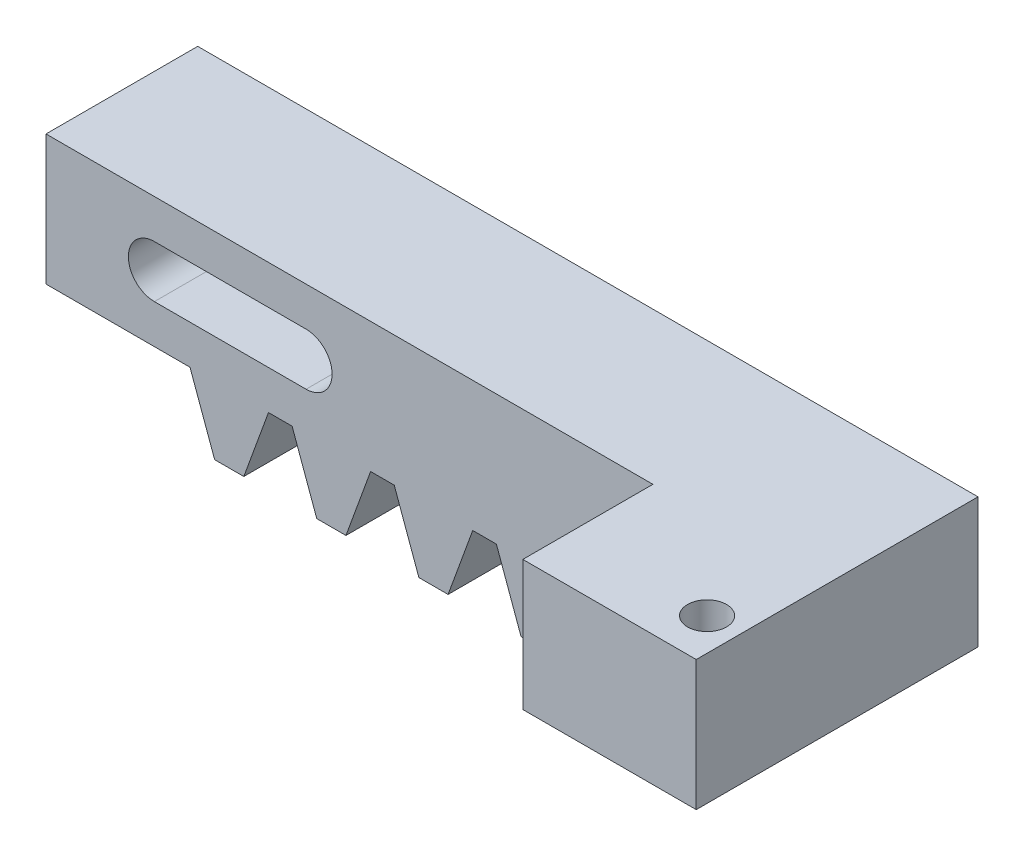
from build123d import *

# Parameters (mm, degrees)
BOSS_EXTRUDE1_START     = 13.5
BOSS_EXTRUDE1_DEPTH     = 7
BOSS_EXTRUDE2_START     = 20.5
SKETCH2_W               = 8
SKETCH2_H               = 6
BOSS_EXTRUDE2_DEPTH     = 6
CUT_EXTRUDE1_DEPTH      = 39.389329572
CUT_EXTRUDE1_DEPTH_BACK = 39.389329572
SKETCH3_R               = 0.9
CUT_EXTRUDE2_DEPTH      = 39.389329572
CUT_EXTRUDE2_DEPTH_BACK = 39.389329572
SKETCH4_W               = 7
SKETCH4_H               = 2.4
CUT_EXTRUDE3_DEPTH      = 39.389329572
CUT_EXTRUDE3_DEPTH_BACK = 39.389329572
SKETCH5_R               = 1.2


with BuildPart() as part:
    # Sketch1 → Boss-Extrude1 (new body)
    with BuildSketch(Plane.XY.offset(BOSS_EXTRUDE1_START)):
        Polygon((-16.7, 19.975), (19.3, 19.975), (19.3, 13.975), (17.125805621, 13.975), (15.988398639, 10.85), (14.642129734, 10.85), (13.504722752, 13.975), (12.41341664, 13.975), (11.276009658, 10.85), (9.929740754, 10.85), (8.792333772, 13.975), (7.70102766, 13.975), (6.563620678, 10.85), (5.217351773, 10.85), (4.079944791, 13.975), (2.988638679, 13.975), (1.851231697, 10.85), (0.504962793, 10.85), (-0.632444189, 13.975), (-1.723750301, 13.975), (-2.861157283, 10.85), (-4.207426188, 10.85), (-5.34483317, 13.975), (-6.436139281, 13.975), (-7.573546263, 10.85), (-8.919815168, 10.85), (-10.05722215, 13.975), (-16.7, 13.975), align=None)
    extrude(amount=BOSS_EXTRUDE1_DEPTH)

    # Sketch2 → Boss-Extrude2 (add)
    with BuildSketch(Plane.XY.offset(BOSS_EXTRUDE2_START)):
        with Locations((15.3, 16.975)):
            Rectangle(SKETCH2_W, SKETCH2_H)
    extrude(amount=BOSS_EXTRUDE2_DEPTH)

    # Sketch3 → Cut-Extrude1 (cut, two sides: drawn at the far end of the back side and taken through both)
    with BuildSketch(Plane(origin=(0, 0, 0), x_dir=(1, 0, 0), z_dir=(0, 1, 0)).offset(-CUT_EXTRUDE1_DEPTH_BACK)):
        with Locations((17.8, -24.5)):
            Circle(SKETCH3_R)
    extrude(amount=CUT_EXTRUDE1_DEPTH + CUT_EXTRUDE1_DEPTH_BACK, mode=Mode.SUBTRACT)

    # Sketch4 → Cut-Extrude2 (cut, two sides: drawn at the far end of the back side and taken through both)
    with BuildSketch(Plane.XY.offset(-CUT_EXTRUDE2_DEPTH_BACK)):
        with Locations((-8.2, 16.975)):
            Rectangle(SKETCH4_W, SKETCH4_H)
    extrude(amount=CUT_EXTRUDE2_DEPTH + CUT_EXTRUDE2_DEPTH_BACK, mode=Mode.SUBTRACT)

    # Sketch5 → Cut-Extrude3 (cut, two sides: drawn at the far end of the back side and taken through both)
    with BuildSketch(Plane.XY.offset(-CUT_EXTRUDE3_DEPTH_BACK)):
        with Locations((-11.7, 16.975)):
            Circle(SKETCH5_R)
        with Locations((-4.7, 16.975)):
            Circle(SKETCH5_R)
    extrude(amount=CUT_EXTRUDE3_DEPTH + CUT_EXTRUDE3_DEPTH_BACK, mode=Mode.SUBTRACT)


solid = part.part
